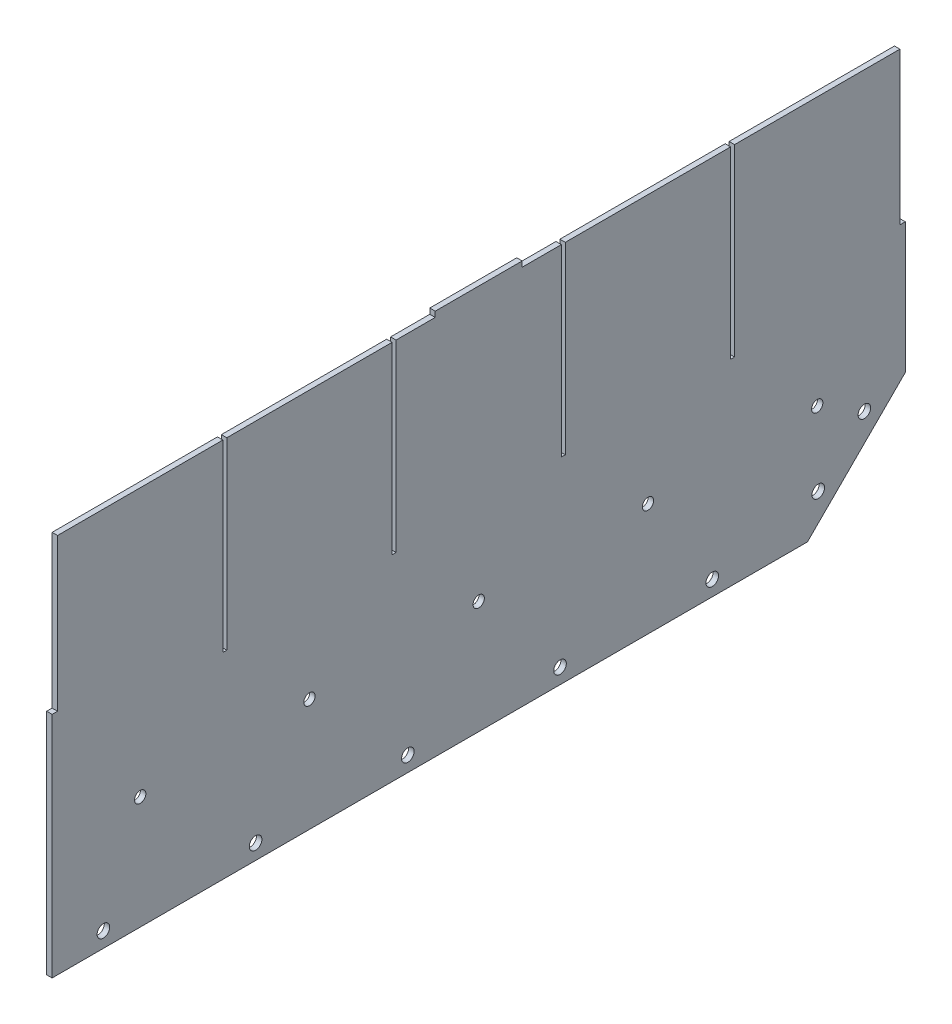
from build123d import *

# Parameters (mm, degrees)
SKETCH1_W            = 498.348
SKETCH1_H            = 165.1
BOSS_EXTRUDE1_DEPTH  = 1.5875
BOSS_EXTRUDE2_DEPTH  = 3.175
SKETCH3_R            = 3.675
CUT_EXTRUDE1_DEPTH   = 3.175
LPATTERN1_COUNT      = 5
LPATTERN1_PITCH      = 88.9
CUT_EXTRUDE2_DEPTH   = 286.681383539
LPATTERN2_COUNT      = 2
LPATTERN2_PITCH      = 38.1
SKETCH5_W            = 3.175
SKETCH5_H            = 88.9
CUT_EXTRUDE3_DEPTH   = 286.681383539
SKETCH6_W            = 2.286
SKETCH6_H            = 107.442
CUT_EXTRUDE4_DEPTH   = 286.681383539
LPATTERN3_COUNT      = 4
LPATTERN3_PITCH      = 98.8568
SKETCH7_W            = 50.8
SKETCH7_H            = 3.175
BOSS_EXTRUDE3_DEPTH  = 3.175
M6_CLEARANCE_HOLE1_D = 6.6
LPATTERN4_COUNT      = 3
LPATTERN4_PITCH      = 98.8568
LPATTERN4_COUNT_DIR2 = 3
LPATTERN4_PITCH_DIR2 = 98.8568


with BuildPart() as part:
    # Sketch1 → Boss-Extrude1 (new, symmetric)
    with BuildSketch(Plane(origin=(0, 0, 0), x_dir=(0, 0, -1), z_dir=(1, 0, 0))):
        Rectangle(SKETCH1_W, SKETCH1_H)
    extrude(amount=BOSS_EXTRUDE1_DEPTH, both=True)

    # Sketch2 → Boss-Extrude2 (add)
    with BuildSketch(Plane(origin=(1.5875, 0, 0), x_dir=(0, 0, -1), z_dir=(1, 0, 0))):
        Polygon((-249.174, -139.7), (192.024, -139.7), (249.174, -82.55), (-249.174, -82.55), align=None)
    extrude(amount=-BOSS_EXTRUDE2_DEPTH)

    # Sketch3 → Cut-Extrude1 (cut)
    with BuildSketch(Plane(origin=(1.5875, 0, 0), x_dir=(0, 0, -1), z_dir=(1, 0, 0))):
        with Locations((-219.202, -130.81)):
            Circle(SKETCH3_R)
    cut_extrude1 = extrude(amount=-CUT_EXTRUDE1_DEPTH, mode=Mode.SUBTRACT)

    # LPattern1: Cut-Extrude1 ×5
    with Locations(*[(0, 0, -i * LPATTERN1_PITCH) for i in range(1, LPATTERN1_COUNT)]):
        add(cut_extrude1, mode=Mode.SUBTRACT)

    # Sketch4 → Cut-Extrude2 (cut, through all)
    with BuildSketch(Plane(origin=(1.5875, 0, 0), x_dir=(0, 0, -1), z_dir=(1, 0, 0))):
        with BuildLine():
            ThreePointArc((195.711561864, -119.847977118), (199.716540899, -120.644616979), (201.985179285, -117.249359697))
            ThreePointArc((201.985179285, -117.249359697), (196.903817671, -113.854102415), (195.711561864, -119.847977118))
        make_face()
    cut_extrude2 = extrude(amount=-CUT_EXTRUDE2_DEPTH, mode=Mode.SUBTRACT)

    # LPattern2: Cut-Extrude2 ×2
    with Locations(*[Vector(0, 0.7071067811865489, -0.7071067811865461) * (i * LPATTERN2_PITCH) for i in range(1, LPATTERN2_COUNT)]):
        add(cut_extrude2, mode=Mode.SUBTRACT)

    # Sketch5 → Cut-Extrude3 (cut, through all)
    with BuildSketch(Plane.ZY.offset(1.5875)):
        with Locations((-247.5865, 38.1)):
            Rectangle(SKETCH5_W, SKETCH5_H)
        with Locations((247.5865, 38.1)):
            Rectangle(SKETCH5_W, SKETCH5_H)
    extrude(amount=-CUT_EXTRUDE3_DEPTH, mode=Mode.SUBTRACT)

    # Sketch6 → Cut-Extrude4 (cut, through all)
    with BuildSketch(Plane.ZY.offset(1.5875)):
        with Locations((-148.2852, 28.829)):
            Rectangle(SKETCH6_W, SKETCH6_H)
    cut_extrude4 = extrude(amount=-CUT_EXTRUDE4_DEPTH, mode=Mode.SUBTRACT)

    # LPattern3: Cut-Extrude4 ×4
    with Locations(*[(0, 0, i * LPATTERN3_PITCH) for i in range(1, LPATTERN3_COUNT)]):
        add(cut_extrude4, mode=Mode.SUBTRACT)

    # Sketch7 → Boss-Extrude3 (add)
    with BuildSketch(Plane.ZY.offset(1.5875)):
        with Locations((0, 84.1375)):
            Rectangle(SKETCH7_W, SKETCH7_H)
    extrude(amount=-BOSS_EXTRUDE3_DEPTH)

    # M6 Clearance Hole1 (through all)
    with Locations(Plane(origin=(1.5875, 0, 0), x_dir=(0, 0, -1), z_dir=(1, 0, 0))):
        with Locations((0, -73.8124)):
            m6_clearance_hole1 = Hole(M6_CLEARANCE_HOLE1_D / 2)

    # LPattern4: M6 Clearance Hole1 3 × 3
    with Locations(*[Vector(0, 0, 1) * (i * LPATTERN4_PITCH) + Vector(0, 0, -1) * (j * LPATTERN4_PITCH_DIR2) for i in range(LPATTERN4_COUNT) for j in range(LPATTERN4_COUNT_DIR2) if (i, j) != (0, 0)]):
        add(m6_clearance_hole1, mode=Mode.SUBTRACT)


solid = part.part
